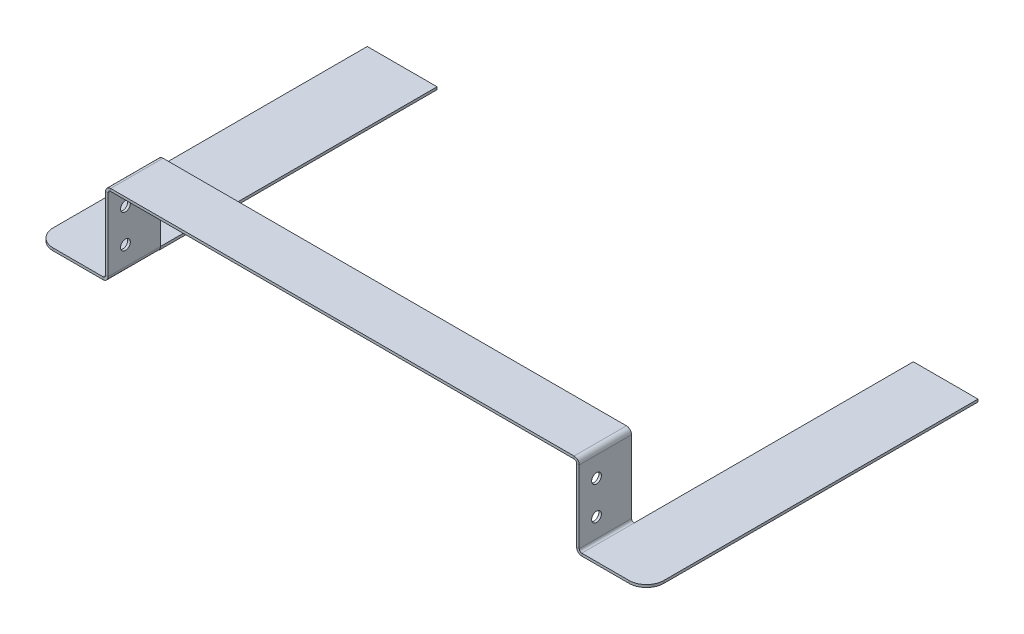
from build123d import *

# Parameters (mm, degrees)
SKETCH1_W                     = 20
SKETCH1_H                     = 95
BASE_FLANGE1_DEPTH            = 0.7366
EDGE_FLANGE1_STRIP_W          = 4.4196
EDGE_FLANGE1_STRIP_H          = 0.7366
EDGE_FLANGE1_STRIP_CUT_DEPTH  = 15
EDGE_FLANGE1_RELIEF_W         = 4.7879
EDGE_FLANGE1_RELIEF_H         = 0.3683
EDGE_FLANGE1_RELIEF_CUT_DEPTH = 0.7366
EDGE_FLANGE1_DEPTH            = 15
EDGE_FLANGE2_STRIP_W          = 4.4196
EDGE_FLANGE2_STRIP_H          = 0.7366
EDGE_FLANGE2_STRIP_CUT_DEPTH  = 15
EDGE_FLANGE2_DEPTH            = 15
EDGE_FLANGE3_STRIP_W          = 4.4196
EDGE_FLANGE3_STRIP_H          = 0.7366
EDGE_FLANGE3_STRIP_CUT_DEPTH  = 15
EDGE_FLANGE3_DEPTH            = 15
EDGE_FLANGE4_STRIP_W          = 4.4196
EDGE_FLANGE4_STRIP_H          = 0.7366
EDGE_FLANGE4_STRIP_CUT_DEPTH  = 15
EDGE_FLANGE4_DEPTH            = 15
SKETCH20_W                    = 18.5268
SKETCH20_H                    = 80
TAB1_DEPTH                    = 0.7366
CUT_EXTRUDE1_DEPTH            = 267.594423465
CUT_EXTRUDE1_DEPTH_BACK       = 267.594423465
SKETCH23_R                    = 1.4
CUT_EXTRUDE2_DEPTH            = 267.594423465
CUT_EXTRUDE2_DEPTH_BACK       = 267.594423465
SKETCH24_R                    = 1.4
FILLET3_R                     = 5
FILLET4_R                     = 5


# Sheet-metal steps are written as plain solids
with BuildPart() as part:
    # Sketch1 → Base-Flange1 (new body)
    with BuildSketch(Plane(origin=(0, 0, 0), x_dir=(1, 0, 0), z_dir=(0, 1, 0))):
        Rectangle(SKETCH1_W, SKETCH1_H)
    extrude(amount=-BASE_FLANGE1_DEPTH)

    # Edge-Flange1 strip (across the edge) → Edge-Flange1 strip cut (cut)
    with BuildSketch(Plane(origin=(10, 0, 47.5), x_dir=(-1, 0, 0), z_dir=(0, 0, -1))):
        with Locations((-1.4732, -0.3683)):
            Rectangle(EDGE_FLANGE1_STRIP_W, EDGE_FLANGE1_STRIP_H)
    extrude(amount=EDGE_FLANGE1_STRIP_CUT_DEPTH, mode=Mode.SUBTRACT)

    # Edge-Flange1 relief (on the sheet) → Edge-Flange1 relief cut (cut)
    with BuildSketch(Plane(origin=(9.2634, 0, 47.5), x_dir=(-1, 0, 0), z_dir=(0, 1, 0))):
        with Locations((-2.02565, -15.18415)):
            Rectangle(EDGE_FLANGE1_RELIEF_W, EDGE_FLANGE1_RELIEF_H)
    extrude(amount=-EDGE_FLANGE1_RELIEF_CUT_DEPTH, mode=Mode.SUBTRACT)

    # Edge-Flange1 section (across the edge) → Edge-Flange1 (add)
    with BuildSketch(Plane(origin=(10, 0, 47.5), x_dir=(-1, 0, 0), z_dir=(0, 0, -1))):
        with BuildLine():
            Line((-0.7366, 0.7366), (-0.7366, 22.2634))
            Line((-0.7366, 22.2634), (0, 22.2634))
            Line((0, 22.2634), (0, 0.7366))
            ThreePointArc((0, 0.7366), (0.215745145, 0.215745145), (0.7366, 0))
            Line((0.7366, 0), (0.7366, -0.7366))
            ThreePointArc((0.7366, -0.7366), (-0.30510971, -0.30510971), (-0.7366, 0.7366))
        make_face()
    extrude(amount=EDGE_FLANGE1_DEPTH)

    # Edge-Flange2 strip (across the edge) → Edge-Flange2 strip cut (cut)
    with BuildSketch(Plane(origin=(10.7366, 22.2634, 32.5), x_dir=(0, -1, 0), z_dir=(0, 0, 1))):
        with Locations((-1.4732, -0.3683)):
            Rectangle(EDGE_FLANGE2_STRIP_W, EDGE_FLANGE2_STRIP_H)
    extrude(amount=EDGE_FLANGE2_STRIP_CUT_DEPTH, mode=Mode.SUBTRACT)

    # Edge-Flange2 section (across the edge) → Edge-Flange2 (add)
    with BuildSketch(Plane(origin=(10.7366, 22.2634, 32.5), x_dir=(0, -1, 0), z_dir=(0, 0, 1))):
        with BuildLine():
            Line((-0.7366, 0.7366), (-0.7366, 134.2634))
            Line((-0.7366, 134.2634), (0, 134.2634))
            Line((0, 134.2634), (0, 0.7366))
            ThreePointArc((0, 0.7366), (0.215745145, 0.215745145), (0.7366, 0))
            Line((0.7366, 0), (0.7366, -0.7366))
            ThreePointArc((0.7366, -0.7366), (-0.30510971, -0.30510971), (-0.7366, 0.7366))
        make_face()
    extrude(amount=EDGE_FLANGE2_DEPTH)

    # Edge-Flange3 strip (across the edge) → Edge-Flange3 strip cut (cut)
    with BuildSketch(Plane(origin=(145, 22.2634, 32.5), x_dir=(-1, 0, 0), z_dir=(0, 0, 1))):
        with Locations((-1.4732, -0.3683)):
            Rectangle(EDGE_FLANGE3_STRIP_W, EDGE_FLANGE3_STRIP_H)
    extrude(amount=EDGE_FLANGE3_STRIP_CUT_DEPTH, mode=Mode.SUBTRACT)

    # Edge-Flange3 section (across the edge) → Edge-Flange3 (add)
    with BuildSketch(Plane(origin=(145, 22.2634, 32.5), x_dir=(-1, 0, 0), z_dir=(0, 0, 1))):
        with BuildLine():
            Line((-0.7366, 0.7366), (-0.7366, 22.2634))
            Line((-0.7366, 22.2634), (0, 22.2634))
            Line((0, 22.2634), (0, 0.7366))
            ThreePointArc((0, 0.7366), (0.215745145, 0.215745145), (0.7366, 0))
            Line((0.7366, 0), (0.7366, -0.7366))
            ThreePointArc((0.7366, -0.7366), (-0.30510971, -0.30510971), (-0.7366, 0.7366))
        make_face()
    extrude(amount=EDGE_FLANGE3_DEPTH)

    # Edge-Flange4 strip (across the edge) → Edge-Flange4 strip cut (cut)
    with BuildSketch(Plane(origin=(145.7366, 0, 47.5), x_dir=(0, 1, 0), z_dir=(0, 0, -1))):
        with Locations((-1.4732, -0.3683)):
            Rectangle(EDGE_FLANGE4_STRIP_W, EDGE_FLANGE4_STRIP_H)
    extrude(amount=EDGE_FLANGE4_STRIP_CUT_DEPTH, mode=Mode.SUBTRACT)

    # Edge-Flange4 section (across the edge) → Edge-Flange4 (add)
    with BuildSketch(Plane(origin=(145.7366, 0, 47.5), x_dir=(0, 1, 0), z_dir=(0, 0, -1))):
        with BuildLine():
            Line((-0.7366, 0.7366), (-0.7366, 19.2634))
            Line((-0.7366, 19.2634), (0, 19.2634))
            Line((0, 19.2634), (0, 0.7366))
            ThreePointArc((0, 0.7366), (0.215745145, 0.215745145), (0.7366, 0))
            Line((0.7366, 0), (0.7366, -0.7366))
            ThreePointArc((0.7366, -0.7366), (-0.30510971, -0.30510971), (-0.7366, 0.7366))
        make_face()
    extrude(amount=EDGE_FLANGE4_DEPTH)

    # Sketch20 → Tab1 (add)
    with BuildSketch(Plane(origin=(0, 0, 0), x_dir=(1, 0, 0), z_dir=(0, 1, 0))):
        with Locations((155.7366, 7.5)):
            Rectangle(SKETCH20_W, SKETCH20_H)
    extrude(amount=-TAB1_DEPTH)

    # Sketch23 → Cut-Extrude1 (cut, two sides: drawn at the far end of the back side and taken through both)
    with BuildSketch(Plane(origin=(10.7366, -49.681752082, -157.421333583), x_dir=(0, 0, -1), z_dir=(1, 0, 0)).offset(-CUT_EXTRUDE1_DEPTH_BACK)):
        with Locations(Location((-199.95707875, 65.413752097, 0), (0, 0, 270))):
            Circle(SKETCH23_R)
    extrude(amount=CUT_EXTRUDE1_DEPTH + CUT_EXTRUDE1_DEPTH_BACK, mode=Mode.SUBTRACT)

    # Sketch24 → Cut-Extrude2 (cut, two sides: drawn at the far end of the back side and taken through both)
    with BuildSketch(Plane(origin=(10.7366, -49.681752082, -157.421333583), x_dir=(0, 0, -1), z_dir=(1, 0, 0)).offset(-CUT_EXTRUDE2_DEPTH_BACK)):
        with Locations(Location((-199.95707875, 55.863752097, 0), (0, 0, 270))):
            Circle(SKETCH24_R)
    extrude(amount=CUT_EXTRUDE2_DEPTH + CUT_EXTRUDE2_DEPTH_BACK, mode=Mode.SUBTRACT)

    # Fillet3
    fillet3_edges = [part.edges().sort_by_distance(p)[0] for p in [
        (-10, -0.3683, 47.5),
    ]]
    fillet(fillet3_edges, radius=FILLET3_R)

    # Fillet4
    fillet4_edges = [part.edges().sort_by_distance(p)[0] for p in [
        (165, -0.3683, 47.5),
    ]]
    fillet(fillet4_edges, radius=FILLET4_R)


solid = part.part
